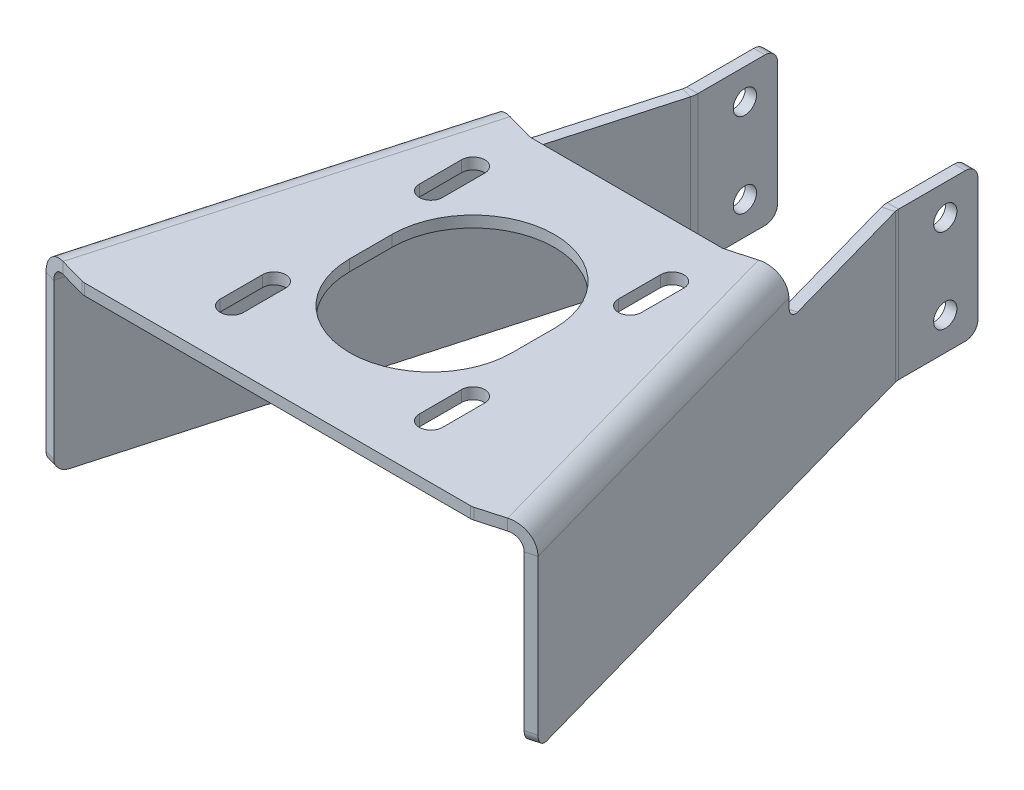
from build123d import *

# Parameters (mm, degrees)
BASE_FLANGE1_DEPTH             = 2.65684
EDGE_FLANGE2_STRIP_W           = 16.97736
EDGE_FLANGE2_STRIP_H           = 2.65684
EDGE_FLANGE2_STRIP_CUT_DEPTH   = 85.842119192
EDGE_FLANGE2_STRIP_2_W         = 16.97736
EDGE_FLANGE2_STRIP_2_H         = 2.65684
EDGE_FLANGE2_STRIP_CUT_2_DEPTH = 85.842119192
EDGE_FLANGE2_DEPTH             = 85.842119192
EDGE_FLANGE2_BEND_DEPTH        = 85.842119192
SKETCH22_W                     = 2.65684
SKETCH22_H                     = 35
BOSS_EXTRUDE1_DEPTH            = 36.846685
SKETCH24_W                     = 2.65684
SKETCH24_H                     = 35
BOSS_EXTRUDE2_DEPTH            = 36.846685
EDGE_FLANGE3_STRIP_CUT_DEPTH   = 35
EDGE_FLANGE3_DEPTH             = 35
EDGE_FLANGE4_STRIP_CUT_DEPTH   = 35
EDGE_FLANGE4_DEPTH             = 35
SKETCH32_R                     = 2.75
CUT_EXTRUDE1_DEPTH             = 198.310511697
FILLET1_R                      = 3


# Sheet-metal steps are written as plain solids
with BuildPart() as part:
    # Sketch4 → Base-Flange1 (new body)
    with BuildSketch(Plane(origin=(0, 95.2, 0), x_dir=(1, 0, 0), z_dir=(0, 1, 0))):
        Polygon((-55.697100796, -148.712214058), (-46.070125043, -151.418011142), (46.070125043, -151.418011142), (55.697100796, -148.712214058), (32.469965214, -66.072214058), (22.842989462, -68.778011142), (-22.842989462, -68.778011142), (-32.469965214, -66.072214058), align=None)
        with BuildLine():
            Line((-26.32, -128.668011142), (-26.32, -138.668011142))
            ThreePointArc((-26.32, -138.668011142), (-23.57, -141.418011142), (-20.82, -138.668011142))
            Line((-20.82, -138.668011142), (-20.82, -128.668011142))
            ThreePointArc((-20.82, -128.668011142), (-23.57, -125.918011142), (-26.32, -128.668011142))
        make_face(mode=Mode.SUBTRACT)
        with BuildLine():
            Line((20.82, -128.668011142), (20.82, -138.668011142))
            ThreePointArc((20.82, -138.668011142), (23.57, -141.418011142), (26.32, -138.668011142))
            Line((26.32, -138.668011142), (26.32, -128.668011142))
            ThreePointArc((26.32, -128.668011142), (23.57, -125.918011142), (20.82, -128.668011142))
        make_face(mode=Mode.SUBTRACT)
        with BuildLine():
            Line((20.82, -91.528011142), (20.82, -81.528011142))
            ThreePointArc((20.82, -81.528011142), (23.57, -78.778011142), (26.32, -81.528011142))
            Line((26.32, -81.528011142), (26.32, -91.528011142))
            ThreePointArc((26.32, -91.528011142), (23.57, -94.278011142), (20.82, -91.528011142))
        make_face(mode=Mode.SUBTRACT)
        with BuildLine():
            Line((-19.25, -105.098011142), (-19.25, -115.098011142))
            ThreePointArc((-19.25, -115.098011142), (0, -134.348011142), (19.25, -115.098011142))
            Line((19.25, -115.098011142), (19.25, -105.098011142))
            ThreePointArc((19.25, -105.098011142), (0, -85.848011142), (-19.25, -105.098011142))
        make_face(mode=Mode.SUBTRACT)
        with BuildLine():
            Line((-20.82, -91.528011142), (-20.82, -81.528011142))
            ThreePointArc((-20.82, -81.528011142), (-23.57, -78.778011142), (-26.32, -81.528011142))
            Line((-26.32, -81.528011142), (-26.32, -91.528011142))
            ThreePointArc((-26.32, -91.528011142), (-23.57, -94.278011142), (-20.82, -91.528011142))
        make_face(mode=Mode.SUBTRACT)
    extrude(amount=-BASE_FLANGE1_DEPTH)

    # Edge-Flange2 strip (across the edge) → Edge-Flange2 strip cut (cut)
    with BuildSketch(Plane(origin=(32.469965214, 92.54316, 66.072214058), x_dir=(-0.9626975752484609, -3.4914813388431334e-15, 0.2705797084238469), z_dir=(0.2705797084238469, 0, 0.9626975752484609))):
        with Locations((-5.31368, -1.32842)):
            Rectangle(EDGE_FLANGE2_STRIP_W, EDGE_FLANGE2_STRIP_H)
    extrude(amount=EDGE_FLANGE2_STRIP_CUT_DEPTH, mode=Mode.SUBTRACT)

    # Edge-Flange2 strip 2 (across the edge) → Edge-Flange2 strip cut 2 (cut)
    with BuildSketch(Plane(origin=(-55.697100796, 92.54316, 148.712214058), x_dir=(0.9626975752484602, -3.4914813388431334e-15, 0.2705797084238493), z_dir=(0.2705797084238493, 0, -0.9626975752484602))):
        with Locations((-5.31368, -1.32842)):
            Rectangle(EDGE_FLANGE2_STRIP_2_W, EDGE_FLANGE2_STRIP_2_H)
    extrude(amount=EDGE_FLANGE2_STRIP_CUT_2_DEPTH, mode=Mode.SUBTRACT)

    # Edge-Flange2 section (across the edge) → Edge-Flange2 (add)
    with BuildSketch(Plane(origin=(32.469965214, 92.54316, 66.072214058), x_dir=(-0.9626975752484609, -3.4914813388431334e-15, 0.2705797084238469), z_dir=(0.2705797084238469, 0, 0.9626975752484609))):
        with BuildLine():
            Line((-2.65684, 3.175), (-2.65684, 42.84316))
            Line((-2.65684, 42.84316), (0, 42.84316))
            Line((0, 42.84316), (0, 3.175))
            ThreePointArc((0, 3.175), (0.92993597, 0.92993597), (3.175, 0))
            Line((3.175, 0), (3.175, -2.65684))
            ThreePointArc((3.175, -2.65684), (-0.948733611, -0.948733611), (-2.65684, 3.175))
        make_face()
    extrude(amount=EDGE_FLANGE2_DEPTH)

    # Edge-Flange2 section 2 (across the edge) → Edge-Flange2 bend (add)
    with BuildSketch(Plane(origin=(-55.697100796, 92.54316, 148.712214058), x_dir=(0.9626975752484602, -3.4914813388431334e-15, 0.2705797084238493), z_dir=(0.2705797084238493, 0, -0.9626975752484602))):
        with BuildLine():
            Line((-2.65684, 3.175), (-2.65684, 42.84316))
            Line((-2.65684, 42.84316), (0, 42.84316))
            Line((0, 42.84316), (0, 3.175))
            ThreePointArc((0, 3.175), (0.92993597, 0.92993597), (3.175, 0))
            Line((3.175, 0), (3.175, -2.65684))
            ThreePointArc((3.175, -2.65684), (-0.948733611, -0.948733611), (-2.65684, 3.175))
        make_face()
    extrude(amount=EDGE_FLANGE2_BEND_DEPTH)

    # Sketch22 → Boss-Extrude1 (add)
    with BuildSketch(Plane(origin=(19.588150967, 0, 69.69282933), x_dir=(-0.9626975752484609, 0, 0.2705797084238468), z_dir=(-0.2705797084238468, 0, -0.9626975752484609))):
        with Locations((-14.709376365, 67.2)):
            Rectangle(SKETCH22_W, SKETCH22_H)
    extrude(amount=BOSS_EXTRUDE1_DEPTH)

    # Sketch24 → Boss-Extrude2 (add)
    with BuildSketch(Plane(origin=(-19.588150967, 0, 69.69282933), x_dir=(-0.9626975752484602, 0, -0.27057970842384926), z_dir=(0.27057970842384926, 0, -0.9626975752484602))):
        with Locations((14.709376365, 67.2)):
            Rectangle(SKETCH24_W, SKETCH24_H)
    extrude(amount=BOSS_EXTRUDE2_DEPTH)

    # Edge-Flange3 strip (across the edge) → Edge-Flange3 strip cut (cut)
    with BuildSketch(Plane(origin=(25.057733426, 49.7, 29.881113007), x_dir=(1, 0, 0), z_dir=(0, 1, 0))):
        Polygon((-7.033027346, 15.203794832), (-2.439298227, -1.140268474), (0.118435199, -0.421381482), (-4.47529392, 15.922681824), align=None)
    extrude(amount=EDGE_FLANGE3_STRIP_CUT_DEPTH, mode=Mode.SUBTRACT)

    # Edge-Flange3 section (across the edge) → Edge-Flange3 (add)
    with BuildSketch(Plane(origin=(25.057733426, 49.7, 29.881113007), x_dir=(1, 0, 0), z_dir=(0, 1, 0))):
        with BuildLine():
            Line((-2.65684, 0.437709092), (-2.65684, 19.281113007))
            Line((-2.65684, 19.281113007), (0, 19.281113007))
            Line((0, 19.281113007), (0, 0.437709092))
            ThreePointArc((0, 0.437709092), (0.029748162, 0.004101115), (0.118435199, -0.421381482))
            Line((0.118435199, -0.421381482), (-2.439298227, -1.140268474))
            ThreePointArc((-2.439298227, -1.140268474), (-2.602198575, -0.35874204), (-2.65684, 0.437709092))
        make_face()
    extrude(amount=EDGE_FLANGE3_DEPTH)

    # Edge-Flange4 strip (across the edge) → Edge-Flange4 strip cut (cut)
    with BuildSketch(Plane(origin=(-25.057733426, 84.7, 29.881113007), x_dir=(-1, 0, 0), z_dir=(0, -1, 0))):
        Polygon((-7.033027346, 15.203794832), (-2.439298227, -1.140268474), (0.118435199, -0.421381482), (-4.47529392, 15.922681824), align=None)
    extrude(amount=EDGE_FLANGE4_STRIP_CUT_DEPTH, mode=Mode.SUBTRACT)

    # Edge-Flange4 section (across the edge) → Edge-Flange4 (add)
    with BuildSketch(Plane(origin=(-25.057733426, 84.7, 29.881113007), x_dir=(-1, 0, 0), z_dir=(0, -1, 0))):
        with BuildLine():
            Line((-2.65684, 0.437709092), (-2.65684, 19.281113007))
            Line((-2.65684, 19.281113007), (0, 19.281113007))
            Line((0, 19.281113007), (0, 0.437709092))
            ThreePointArc((0, 0.437709092), (0.029748162, 0.004101115), (0.118435199, -0.421381482))
            Line((0.118435199, -0.421381482), (-2.439298227, -1.140268474))
            ThreePointArc((-2.439298227, -1.140268474), (-2.602198575, -0.35874204), (-2.65684, 0.437709092))
        make_face()
    extrude(amount=EDGE_FLANGE4_DEPTH)

    # Sketch32 → Cut-Extrude1 (cut, through all)
    with BuildSketch(Plane(origin=(25.057733426, 0, 0), x_dir=(0, 0, -1), z_dir=(1, 0, 0))):
        with Locations(Location((-18.35, 77.45, 0), (0, 0, 180))):
            Circle(SKETCH32_R)
        with Locations(Location((-18.35, 57.45, 0), (0, 0, 180))):
            Circle(SKETCH32_R)
    extrude(amount=-CUT_EXTRUDE1_DEPTH, mode=Mode.SUBTRACT)

    # Fillet1
    fillet1_edges = [part.edges().sort_by_distance(p)[0] for p in [
        (56.975967508, 49.7, 148.352770562),
        (-22.842989462, 93.87158, 68.778011142),
        (22.842989462, 93.87158, 68.778011142),
        (46.070125043, 93.87158, 151.418011142),
        (-46.070125043, 93.87158, 151.418011142),
        (-56.975967508, 49.7, 148.352770562),
        (33.748831927, 84.7, 65.712770562),
        (-33.748831927, 84.7, 65.712770562),
        (23.729313426, 49.7, 10.6),
        (23.729313426, 84.7, 10.6),
        (-23.729313426, 84.7, 10.6),
        (-23.729313426, 49.7, 10.6),
    ]]
    fillet(fillet1_edges, radius=FILLET1_R)


solid = part.part
